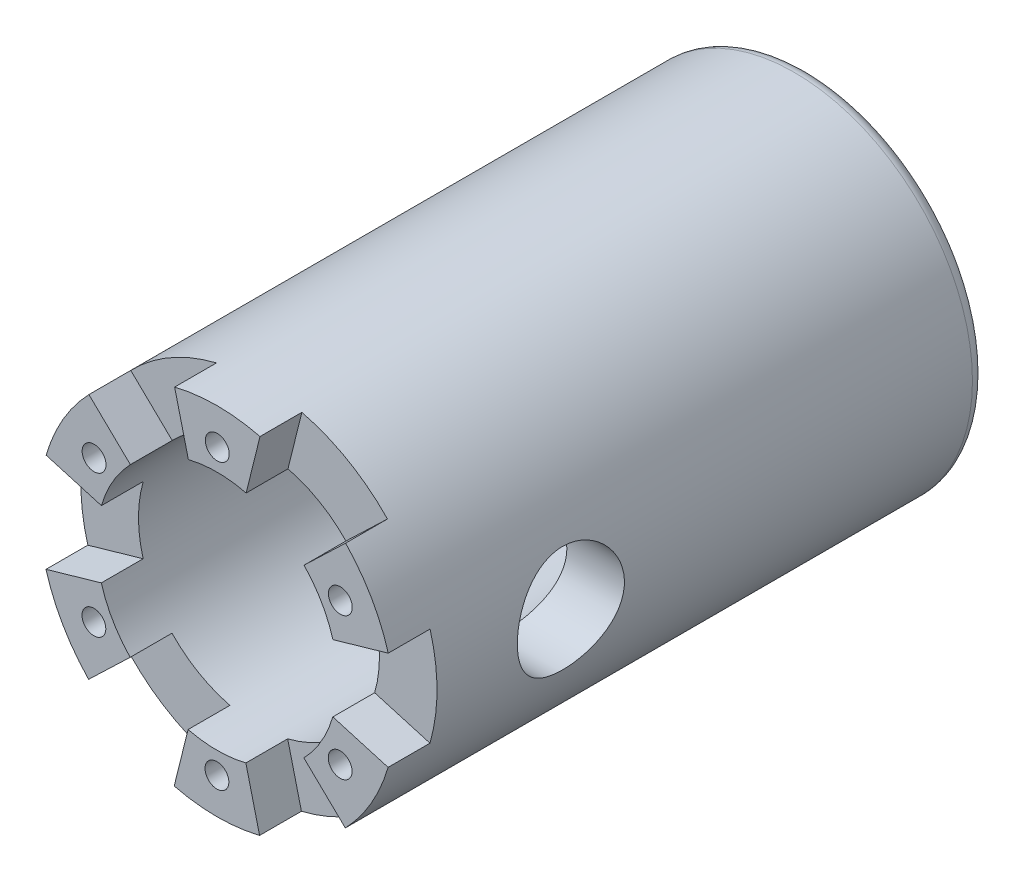
from build123d import *

# Parameters (mm, degrees)
SKETCH1_R                                      = 16.891
BOSS_EXTRUDE1_DEPTH                            = 56.0324
SKETCH9_R                                      = 9.525
CUT_EXTRUDE6_DEPTH                             = 61.911752657
SKETCH10_R                                     = 11.43
BOSS_EXTRUDE2_DEPTH                            = 19.05
CUT_EXTRUDE7_START                             = -52.06365
SKETCH11_R                                     = 9.525
CUT_EXTRUDE7_DEPTH                             = 52.06365
CUT_EXTRUDE8_START                             = -3.96875
CUT_EXTRUDE8_DEPTH                             = 3.96875
CSK_FOR_2_FLAT_HEAD_MACHINE_SCREW1_D           = 2.2606
CSK_FOR_2_FLAT_HEAD_MACHINE_SCREW1_CSINK_D     = 4.3688
CSK_FOR_2_FLAT_HEAD_MACHINE_SCREW1_CSINK_ANGLE = 82
CIRPATTERN1_COUNT                              = 6
F_1_2_0_4_DIAMETER_HOLE1_D                     = 10.16
F_1_2_0_4_DIAMETER_HOLE1_DEPTH                 = 12.7
F_1_2_0_4_DIAMETER_HOLE1_TIP                   = 3.052371945
FILLET1_R                                      = 1.27
CUT_EXTRUDE9_START                             = -12.7
SKETCH17_W                                     = 16.51
SKETCH17_H                                     = 16.51
CUT_EXTRUDE9_DEPTH                             = 12.7


with BuildPart() as part:
    # Sketch1 → Boss-Extrude1 (new body)
    with BuildSketch(Plane.XY):
        Circle(SKETCH1_R)
    extrude(amount=BOSS_EXTRUDE1_DEPTH)

    # Sketch9 → Cut-Extrude6 (cut, through all)
    with BuildSketch(Plane(origin=(0, 0, 0), x_dir=(-1, 0, 0), z_dir=(0, 0, -1))):
        Circle(SKETCH9_R)
        with BuildLine():
            ThreePointArc((-5.359640753, -7.874), (0, -9.525), (5.359640753, -7.874))
            Line((5.359640753, -7.874), (-5.359640753, -7.874))
        make_face()
        with BuildLine():
            ThreePointArc((-7.874, 5.359640753), (-9.525, 0), (-7.874, -5.359640753))
            Line((-7.874, -5.359640753), (-7.874, 5.359640753))
        make_face()
        with BuildLine():
            Line((-5.359640753, 7.874), (5.359640753, 7.874))
            ThreePointArc((5.359640753, 7.874), (0, 9.525), (-5.359640753, 7.874))
        make_face()
        with BuildLine():
            Line((7.874, 5.359640753), (7.874, -5.359640753))
            ThreePointArc((7.874, -5.359640753), (9.102897204, -2.804084075), (9.525, 0))
            ThreePointArc((9.525, 0), (9.102897204, 2.804084075), (7.874, 5.359640753))
        make_face()
    extrude(amount=-CUT_EXTRUDE6_DEPTH, mode=Mode.SUBTRACT)

    # Sketch10 → Boss-Extrude2 (add)
    # profile 1 of 2: a face of its own
    with BuildSketch(Plane(origin=(0, 0, 0), x_dir=(-1, 0, 0), z_dir=(0, 0, -1))):
        Circle(SKETCH10_R)
        with BuildLine():
            ThreePointArc((-5.359640753, -7.874), (-4.453933477, 8.419507206), (9.525, 0))
            ThreePointArc((9.525, 0), (8.419507206, -4.453933477), (5.359640753, -7.874))
            ThreePointArc((5.359640753, -7.874), (0, -9.525), (-5.359640753, -7.874))
        make_face(mode=Mode.SUBTRACT)
    # profile 2 of 2: a face of its own
    with BuildSketch(Plane(origin=(0, 0, 0), x_dir=(-1, 0, 0), z_dir=(0, 0, -1))):
        Circle(SKETCH10_R)
        with BuildLine():
            ThreePointArc((-5.359640753, -7.874), (-4.453933477, 8.419507206), (9.525, 0))
            ThreePointArc((9.525, 0), (8.419507206, -4.453933477), (5.359640753, -7.874))
            ThreePointArc((5.359640753, -7.874), (0, -9.525), (-5.359640753, -7.874))
        make_face(mode=Mode.SUBTRACT)
    extrude(amount=-BOSS_EXTRUDE2_DEPTH)

    # Sketch11 → Cut-Extrude7 (cut)
    with BuildSketch(Plane.XY.offset(56.0324).offset(CUT_EXTRUDE7_START)):
        with BuildLine():
            Line((-9.153468369, -2.634319991), (-10.984162043, -3.161183989))
            ThreePointArc((-10.984162043, -3.161183989), (1.596234295, -11.317991698), (11.43, 0))
            ThreePointArc((11.43, 0), (1.610471515, 11.315974615), (-10.976173491, 3.188810986))
            Line((-10.976173491, 3.188810986), (-9.146811242, 2.657342489))
            ThreePointArc((-9.146811242, 2.657342489), (1.342059596, 9.429978846), (9.525, 0))
            ThreePointArc((9.525, 0), (1.330195246, -9.431659748), (-9.153468369, -2.634319991))
        make_face()
        with Locations(Location((0, 0, 0), (0, 0, 180))):
            Circle(SKETCH11_R)
        with BuildLine():
            ThreePointArc((-10.984162043, -3.161183989), (-11.297244321, 0.014212394), (-10.976173491, 3.188810986))
            Line((-10.976173491, 3.188810986), (0, 0))
            Line((0, 0), (-10.984162043, -3.161183989))
        make_face()
        with BuildLine():
            ThreePointArc((-10.976173491, 3.188810986), (-11.429990955, 0.014379395), (-10.984162043, -3.161183989))
            ThreePointArc((-10.984162043, -3.161183989), (-11.297244321, 0.014212394), (-10.976173491, 3.188810986))
        make_face()
    extrude(amount=CUT_EXTRUDE7_DEPTH, mode=Mode.SUBTRACT)

    # Sketch11<4> → Cut-Extrude8 (cut)
    with BuildSketch(Plane.XY.offset(56.0324).offset(CUT_EXTRUDE8_START)):
        with BuildLine():
            ThreePointArc((-10.976173491, 3.188810986), (-11.297244321, 0.014212394), (-10.984162043, -3.161183989))
            Line((-10.984162043, -3.161183989), (0, 0))
            Line((0, 0), (-10.976173491, 3.188810986))
        make_face()
        with BuildLine():
            ThreePointArc((-10.976173491, 3.188810986), (-11.429990955, 0.014379395), (-10.984162043, -3.161183989))
            ThreePointArc((-10.984162043, -3.161183989), (-11.297244321, 0.014212394), (-10.976173491, 3.188810986))
        make_face()
        with BuildLine():
            Line((-16.232150575, -4.67152745), (-10.984162043, -3.161183989))
            ThreePointArc((-10.984162043, -3.161183989), (-11.429990955, 0.014379395), (-10.976173491, 3.188810986))
            Line((-10.976173491, 3.188810986), (-16.220345269, 4.712354013))
            ThreePointArc((-16.220345269, 4.712354013), (-16.925737574, 0.021293268), (-16.232150575, -4.67152745))
        make_face()
        with BuildLine():
            Line((0, 0), (-10.984162043, -3.161183989))
            ThreePointArc((-10.984162043, -3.161183989), (1.596234295, -11.317991698), (11.43, 0))
            ThreePointArc((11.43, 0), (1.610471515, 11.315974615), (-10.976173491, 3.188810986))
            Line((-10.976173491, 3.188810986), (0, 0))
        make_face()
    cut_extrude8 = extrude(amount=CUT_EXTRUDE8_DEPTH, mode=Mode.SUBTRACT)

    # CSK for #2 Flat Head Machine Screw1 (through all)
    with Locations(Plane(origin=(0, 0, 0), x_dir=(-1, 0, 0), z_dir=(0, 0, -1))):
        with Locations((11.671937945, 6.75838911)):
            csk_for_2_flat_head_machine_screw1 = CounterSinkHole(CSK_FOR_2_FLAT_HEAD_MACHINE_SCREW1_D / 2, CSK_FOR_2_FLAT_HEAD_MACHINE_SCREW1_CSINK_D / 2, counter_sink_angle=CSK_FOR_2_FLAT_HEAD_MACHINE_SCREW1_CSINK_ANGLE)

    # CirPattern1: Cut-Extrude8, CSK for #2 Flat Head Machine Screw1 ×6 about axis
    cirpattern1_axis = Axis((0, 0, 0), (0, 0, 1))
    add([cut_extrude8.rotate(cirpattern1_axis, i * 360 / CIRPATTERN1_COUNT) for i in range(1, CIRPATTERN1_COUNT)], mode=Mode.SUBTRACT)
    add([csk_for_2_flat_head_machine_screw1.rotate(cirpattern1_axis, i * 360 / CIRPATTERN1_COUNT) for i in range(1, CIRPATTERN1_COUNT)], mode=Mode.SUBTRACT)

    # 1/2 (0.4) Diameter Hole1
    with Locations(Plane(origin=(16.890986634, -0.02124955, 39.36365), x_dir=(0.001258039772, 0.999999208668, 0), z_dir=(0.999999208668, -0.001258039772, 0))):
        with Locations((0, 0)):
            Hole(F_1_2_0_4_DIAMETER_HOLE1_D / 2, depth=F_1_2_0_4_DIAMETER_HOLE1_DEPTH)
            with Locations((0, 0, -(F_1_2_0_4_DIAMETER_HOLE1_DEPTH + F_1_2_0_4_DIAMETER_HOLE1_TIP / 2))):  # 118° drill point
                Cone(0, F_1_2_0_4_DIAMETER_HOLE1_D / 2, F_1_2_0_4_DIAMETER_HOLE1_TIP, mode=Mode.SUBTRACT)

    # Fillet1
    # the kernel refuses this fillet: 1.27 mm, written as the material it takes off along each edge
    with BuildSketch(Plane(origin=(0, 0, 0), x_dir=(1, 0, 0), z_dir=(0, -1, 0))) as fillet1_piece_1:
        with BuildLine():
            CenterArc((16.891 - FILLET1_R, FILLET1_R), FILLET1_R, 270, 90)
            Line((16.891 - FILLET1_R, 0), (16.891, 0))
            Line((16.891, 0), (16.891, FILLET1_R))
        make_face()
    revolve(axis=Axis((0, 0, 0), (0, 0, 1)), mode=Mode.SUBTRACT)

    # Sketch17 → Cut-Extrude9 (cut)
    with BuildSketch(Plane(origin=(0, 0, 0), x_dir=(-1, 0, 0), z_dir=(0, 0, -1)).offset(CUT_EXTRUDE9_START)):
        with Locations((-0.016967686, 0.019651839)):
            Rectangle(SKETCH17_W, SKETCH17_H)
    extrude(amount=CUT_EXTRUDE9_DEPTH, mode=Mode.SUBTRACT)


solid = part.part
